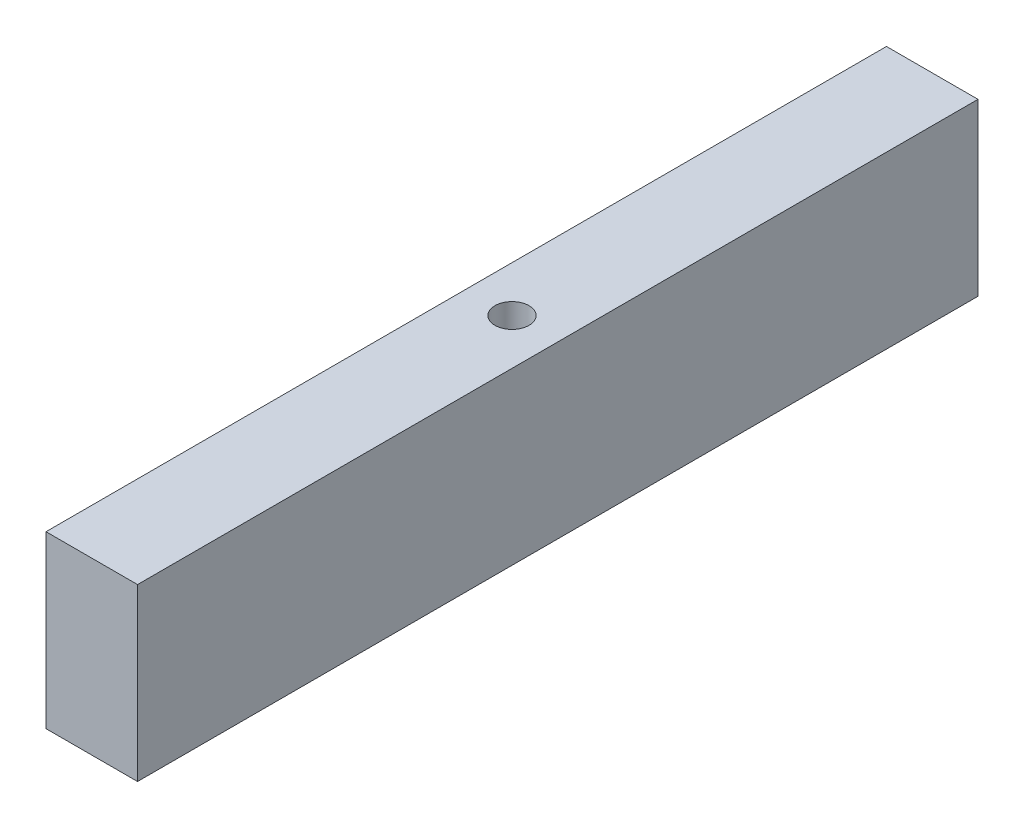
from build123d import *

# Parameters (mm, degrees)
SKETCH1_W           = 22
SKETCH1_H           = 41
BOSS_EXTRUDE1_DEPTH = 101
SKETCH2_R           = 4.1
CUT_EXTRUDE1_DEPTH  = 46


with BuildPart() as part:
    # Sketch1 → Boss-Extrude1 (new, symmetric)
    with BuildSketch(Plane.XY):
        with Locations((0, 20.5)):
            Rectangle(SKETCH1_W, SKETCH1_H)
    extrude(amount=BOSS_EXTRUDE1_DEPTH, both=True)

    # Sketch2 → Cut-Extrude1 (cut, symmetric)
    with BuildSketch(Plane(origin=(0, 0, 0), x_dir=(1, 0, 0), z_dir=(0, 1, 0))):
        Circle(SKETCH2_R)
    extrude(amount=CUT_EXTRUDE1_DEPTH, both=True, mode=Mode.SUBTRACT)


solid = part.part
